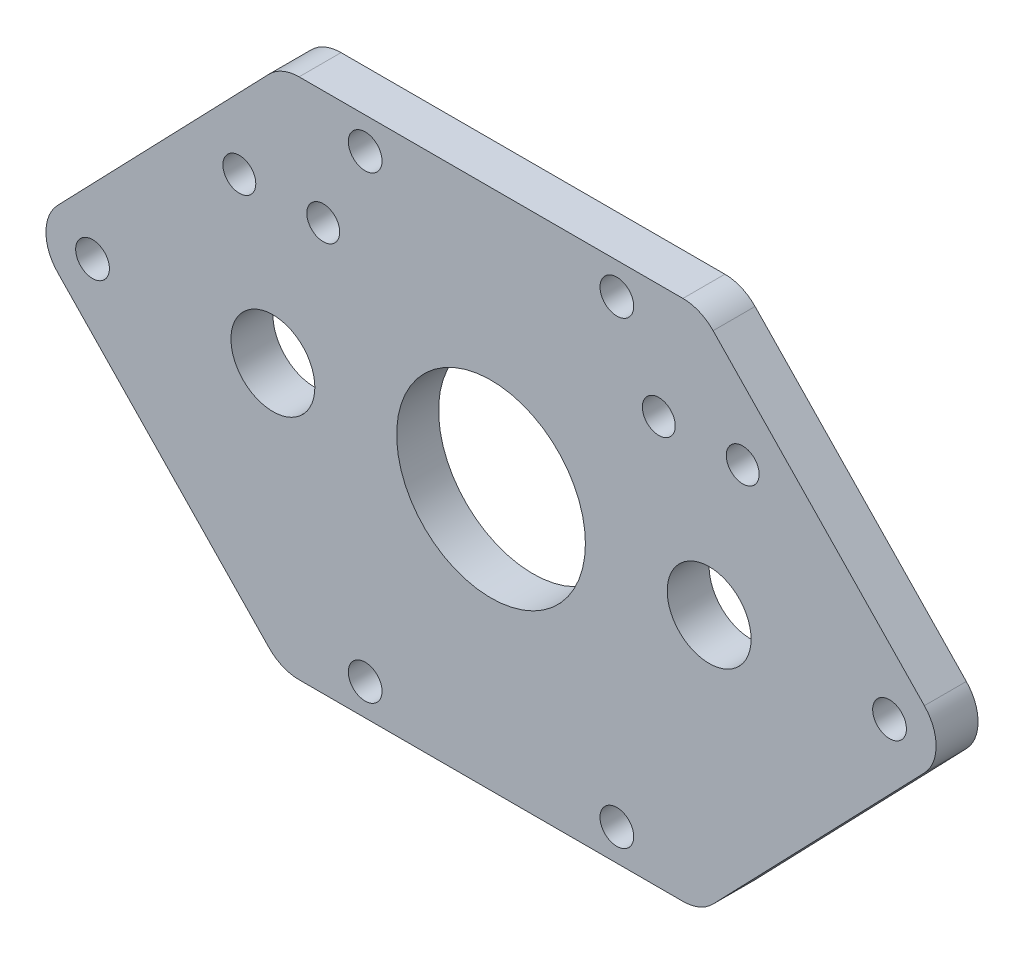
from build123d import *

# Parameters (mm, degrees)
SKETCH5_R           = 2.5527
SKETCH5_R_2         = 6.35
SKETCH5_R_3         = 2.4892
SKETCH5_R_4         = 14.2875
BOSS_EXTRUDE1_DEPTH = 6.35
FILLET2_R           = 6.35


with BuildPart() as part:
    # Sketch5 → Boss-Extrude1 (new body)
    with BuildSketch(Plane.XY):
        Polygon((-69.85, 0), (-31.75, -39.52494), (31.75, -39.52494), (69.85, 0), (31.75, 39.52494), (-31.75, 39.52494), align=None)
        with Locations((-19.05, -34.76244)):
            Circle(SKETCH5_R, mode=Mode.SUBTRACT)
        with Locations((19.05, -34.76244)):
            Circle(SKETCH5_R, mode=Mode.SUBTRACT)
        with Locations((-60.325, 0)):
            Circle(SKETCH5_R, mode=Mode.SUBTRACT)
        with Locations((-33.02, 0)):
            Circle(SKETCH5_R_2, mode=Mode.SUBTRACT)
        with Locations((-38.1, 22.225)):
            Circle(SKETCH5_R_3, mode=Mode.SUBTRACT)
        with Locations((-25.4, 22.225)):
            Circle(SKETCH5_R_3, mode=Mode.SUBTRACT)
        with Locations((-19.05, 34.76244)):
            Circle(SKETCH5_R, mode=Mode.SUBTRACT)
        Circle(SKETCH5_R_4, mode=Mode.SUBTRACT)
        with Locations((33.02, 0)):
            Circle(SKETCH5_R_2, mode=Mode.SUBTRACT)
        with Locations((60.325, 0)):
            Circle(SKETCH5_R, mode=Mode.SUBTRACT)
        with Locations((25.4, 22.225)):
            Circle(SKETCH5_R_3, mode=Mode.SUBTRACT)
        with Locations((19.05, 34.76244)):
            Circle(SKETCH5_R, mode=Mode.SUBTRACT)
        with Locations((38.1, 22.225)):
            Circle(SKETCH5_R_3, mode=Mode.SUBTRACT)
    extrude(amount=BOSS_EXTRUDE1_DEPTH)

    # Fillet2
    fillet2_edges = [part.edges().sort_by_distance(p)[0] for p in [
        (31.75, -39.52494, 3.175),
        (-31.75, -39.52494, 3.175),
        (31.75, 39.52494, 3.175),
        (-31.75, 39.52494, 3.175),
        (69.85, 0, 3.175),
        (-69.85, 0, 3.175),
    ]]
    fillet(fillet2_edges, radius=FILLET2_R)


solid = part.part
